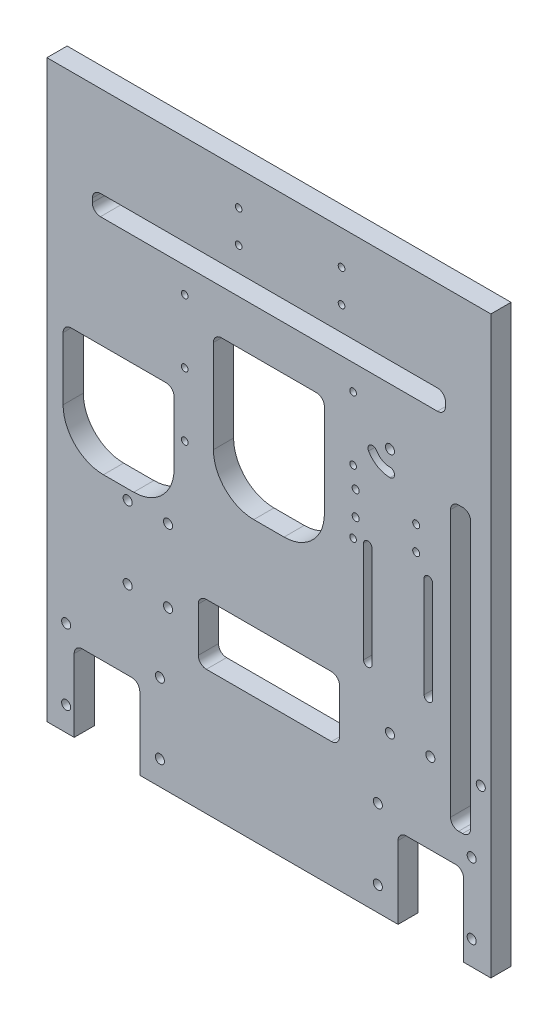
from build123d import *

# Parameters (mm, degrees)
ESQUISSE1_W                   = 220
ESQUISSE1_H                   = 285
BOSS_EXTRU_1_DEPTH            = 10
ESQUISSE2_R                   = 2
ENL_V_MAT_EXTRU_1_DEPTH       = 8
ENL_V_MAT_EXTRU_2_DEPTH       = 361.173569269
ENL_V_MAT_EXTRU_2_DEPTH_BACK  = 361.173569269
ESQUISSE3_W                   = 55
ESQUISSE3_H                   = 70
ESQUISSE3_H_2                 = 55
ESQUISSE3_W_2                 = 10
ESQUISSE3_H_3                 = 140
ENL_V_MAT_EXTRU_3_DEPTH       = 361.173569269
ENL_V_MAT_EXTRU_3_DEPTH_BACK  = 361.173569269
ESQUISSE5_W                   = 175
ESQUISSE5_H                   = 10
ENL_V_MAT_EXTRU_4_DEPTH       = 361.173569269
ENL_V_MAT_EXTRU_4_DEPTH_BACK  = 361.173569269
ESQUISSE6_R                   = 2.25
ESQUISSE6_R_2                 = 1.75
ENL_V_MAT_EXTRU_5_DEPTH       = 361.173569269
ENL_V_MAT_EXTRU_5_DEPTH_BACK  = 361.173569269
ESQUISSE7_R                   = 1.65
ENL_V_MAT_EXTRU_6_DEPTH       = 361.173569269
ENL_V_MAT_EXTRU_6_DEPTH_BACK  = 361.173569269
ESQUISSE8_W                   = 32.5
ESQUISSE8_H                   = 40
CONG_1_R                      = 20
ENL_V_MAT_EXTRU_7_DEPTH       = 361.173569269
ENL_V_MAT_EXTRU_7_DEPTH_BACK  = 361.173569269
ENL_V_MAT_EXTRU_8_DEPTH       = 361.173569269
ENL_V_MAT_EXTRU_8_DEPTH_BACK  = 361.173569269
ESQUISSE10_R                  = 2.25
ENL_V_MAT_EXTRU_9_DEPTH       = 361.173569269
ENL_V_MAT_EXTRU_9_DEPTH_BACK  = 361.173569269
ESQUISSE11_W                  = 70
ESQUISSE11_H                  = 30
CONG_2_R                      = 4
ENL_V_MAT_EXTRU_10_DEPTH      = 361.173569269
ENL_V_MAT_EXTRU_10_DEPTH_BACK = 361.173569269
ESQUISSE12_R                  = 2.25
ENL_V_MAT_EXTRU_11_DEPTH      = 361.173569269
ENL_V_MAT_EXTRU_11_DEPTH_BACK = 361.173569269
ESQUISSE13_R                  = 2.25


with BuildPart() as part:
    # Esquisse1 → Boss.-Extru.1 (new body)
    with BuildSketch(Plane.XY):
        with Locations((110, 142.5)):
            Rectangle(ESQUISSE1_W, ESQUISSE1_H)
    extrude(amount=BOSS_EXTRU_1_DEPTH)

    # Esquisse2 → Enlèv. mat.-Extru.1 (cut)
    with BuildSketch(Plane.XZ):
        with Locations((110, 5)):
            Circle(ESQUISSE2_R)
        with Locations((213, 5)):
            Circle(ESQUISSE2_R)
        with Locations((7, 5)):
            Circle(ESQUISSE2_R)
    extrude(amount=-ENL_V_MAT_EXTRU_1_DEPTH, mode=Mode.SUBTRACT)

    # Esquisse3 → Enlèv. mat.-Extru.2 (cut, two sides: drawn at the far end of the back side and taken through both)
    with BuildSketch(Plane.XY.offset(10).offset(-ENL_V_MAT_EXTRU_2_DEPTH_BACK)):
        with Locations((110, 173)):
            Rectangle(ESQUISSE3_W, ESQUISSE3_H)
        with Locations((35.5, 147.5)):
            Rectangle(ESQUISSE3_W, ESQUISSE3_H_2)
        with Locations((205, 125)):
            Rectangle(ESQUISSE3_W_2, ESQUISSE3_H_3)
    extrude(amount=ENL_V_MAT_EXTRU_2_DEPTH + ENL_V_MAT_EXTRU_2_DEPTH_BACK, mode=Mode.SUBTRACT)

    # Esquisse5 → Enlèv. mat.-Extru.3 (cut, two sides: drawn at the far end of the back side and taken through both)
    with BuildSketch(Plane.XY.offset(10).offset(-ENL_V_MAT_EXTRU_3_DEPTH_BACK)):
        with Locations((110, 235)):
            Rectangle(ESQUISSE5_W, ESQUISSE5_H)
    extrude(amount=ENL_V_MAT_EXTRU_3_DEPTH + ENL_V_MAT_EXTRU_3_DEPTH_BACK, mode=Mode.SUBTRACT)

    # Esquisse6 → Enlèv. mat.-Extru.4 (cut, two sides: drawn at the far end of the back side and taken through both)
    with BuildSketch(Plane.XY.offset(10).offset(-ENL_V_MAT_EXTRU_4_DEPTH_BACK)):
        with Locations((190, 80)):
            Circle(ESQUISSE6_R)
        with Locations((170, 80)):
            Circle(ESQUISSE6_R)
        with Locations((215, 80)):
            Circle(ESQUISSE6_R)
        with Locations((153, 176.25)):
            Circle(ESQUISSE6_R_2)
        with Locations((183, 176.25)):
            Circle(ESQUISSE6_R_2)
        with Locations((183, 164.25)):
            Circle(ESQUISSE6_R_2)
        with Locations((153, 164.25)):
            Circle(ESQUISSE6_R_2)
    extrude(amount=ENL_V_MAT_EXTRU_4_DEPTH + ENL_V_MAT_EXTRU_4_DEPTH_BACK, mode=Mode.SUBTRACT)

    # Esquisse7 → Enlèv. mat.-Extru.5 (cut, two sides: drawn at the far end of the back side and taken through both)
    with BuildSketch(Plane.XY.offset(10).offset(-ENL_V_MAT_EXTRU_5_DEPTH_BACK)):
        with Locations((68.285, 217.4)):
            Circle(ESQUISSE7_R)
        with Locations((68.285, 186)):
            Circle(ESQUISSE7_R)
        with Locations((68.285, 154.6)):
            Circle(ESQUISSE7_R)
        with Locations((151.715, 154.6)):
            Circle(ESQUISSE7_R)
        with Locations((151.715, 186)):
            Circle(ESQUISSE7_R)
        with Locations((151.715, 217.4)):
            Circle(ESQUISSE7_R)
        with Locations((95, 268)):
            Circle(ESQUISSE7_R)
        with Locations((146, 268)):
            Circle(ESQUISSE7_R)
        with Locations((146, 252)):
            Circle(ESQUISSE7_R)
        with Locations((95, 252)):
            Circle(ESQUISSE7_R)
    extrude(amount=ENL_V_MAT_EXTRU_5_DEPTH + ENL_V_MAT_EXTRU_5_DEPTH_BACK, mode=Mode.SUBTRACT)

    # Esquisse8 → Enlèv. mat.-Extru.6 (cut, two sides: drawn at the far end of the back side and taken through both)
    with BuildSketch(Plane.XY.offset(10).offset(-ENL_V_MAT_EXTRU_6_DEPTH_BACK)):
        with Locations((190.25, 20)):
            Rectangle(ESQUISSE8_W, ESQUISSE8_H)
        with Locations((29.75, 20)):
            Rectangle(ESQUISSE8_W, ESQUISSE8_H)
    extrude(amount=ENL_V_MAT_EXTRU_6_DEPTH + ENL_V_MAT_EXTRU_6_DEPTH_BACK, mode=Mode.SUBTRACT)

    # Congé1
    cong_1_edges = [part.edges().sort_by_distance(p)[0] for p in [
        (137.5, 138, 5),
        (82.5, 138, 5),
        (63, 120, 5),
        (8, 120, 5),
    ]]
    fillet(cong_1_edges, radius=CONG_1_R)

    # Esquisse9 → Enlèv. mat.-Extru.7 (cut, two sides: drawn at the far end of the back side and taken through both)
    with BuildSketch(Plane.XY.offset(10).offset(-ENL_V_MAT_EXTRU_7_DEPTH_BACK)):
        with BuildLine():
            Line((191.1, 155), (191.1, 105))
            ThreePointArc((191.1, 105), (189, 102.9), (186.9, 105))
            Line((186.9, 105), (186.9, 155))
            ThreePointArc((186.9, 155), (189, 157.1), (191.1, 155))
        make_face()
        with BuildLine():
            Line((156.9, 105), (156.9, 155))
            ThreePointArc((156.9, 155), (159, 157.1), (161.1, 155))
            Line((161.1, 155), (161.1, 105))
            ThreePointArc((161.1, 105), (159, 102.9), (156.9, 105))
        make_face()
    extrude(amount=ENL_V_MAT_EXTRU_7_DEPTH + ENL_V_MAT_EXTRU_7_DEPTH_BACK, mode=Mode.SUBTRACT)

    # Esquisse10 → Enlèv. mat.-Extru.8 (cut, two sides: drawn at the far end of the back side and taken through both)
    with BuildSketch(Plane.XY.offset(10).offset(-ENL_V_MAT_EXTRU_8_DEPTH_BACK)):
        with Locations((9.5, 12)):
            Circle(ESQUISSE10_R)
        with Locations((9.5, 47)):
            Circle(ESQUISSE10_R)
        with Locations((210.5, 47)):
            Circle(ESQUISSE10_R)
        with Locations((210.5, 12)):
            Circle(ESQUISSE10_R)
        with Locations((56, 47)):
            Circle(ESQUISSE10_R)
        with Locations((56, 12)):
            Circle(ESQUISSE10_R)
        with Locations((164, 12)):
            Circle(ESQUISSE10_R)
        with Locations((164, 47)):
            Circle(ESQUISSE10_R)
    extrude(amount=ENL_V_MAT_EXTRU_8_DEPTH + ENL_V_MAT_EXTRU_8_DEPTH_BACK, mode=Mode.SUBTRACT)

    # Esquisse11 → Enlèv. mat.-Extru.9 (cut, two sides: drawn at the far end of the back side and taken through both)
    with BuildSketch(Plane.XY.offset(10).offset(-ENL_V_MAT_EXTRU_9_DEPTH_BACK)):
        with Locations((110, 77)):
            Rectangle(ESQUISSE11_W, ESQUISSE11_H)
    extrude(amount=ENL_V_MAT_EXTRU_9_DEPTH + ENL_V_MAT_EXTRU_9_DEPTH_BACK, mode=Mode.SUBTRACT)

    # Congé2
    cong_2_edges = [part.edges().sort_by_distance(p)[0] for p in [
        (137.5, 208, 5),
        (82.5, 208, 5),
        (197.5, 230, 5),
        (197.5, 240, 5),
        (22.5, 240, 5),
        (22.5, 230, 5),
        (63, 175, 5),
        (8, 175, 5),
        (200, 195, 5),
        (210, 195, 5),
        (210, 55, 5),
        (200, 55, 5),
        (206.5, 40, 5),
        (174, 40, 5),
        (46, 40, 5),
        (13.5, 40, 5),
        (75, 62, 5),
        (145, 62, 5),
        (145, 92, 5),
        (75, 92, 5),
    ]]
    fillet(cong_2_edges, radius=CONG_2_R)

    # Esquisse12 → Enlèv. mat.-Extru.10 (cut, two sides: drawn at the far end of the back side and taken through both)
    with BuildSketch(Plane.XY.offset(10).offset(-ENL_V_MAT_EXTRU_10_DEPTH_BACK)):
        with Locations((170, 202)):
            Circle(ESQUISSE12_R)
        with BuildLine():
            ThreePointArc((159.391188804, 195.875), (163.875, 191.391188804), (170, 189.75))
            ThreePointArc((170, 189.75), (172.25, 192), (170, 194.25))
            ThreePointArc((170, 194.25), (166.125, 195.288303121), (163.288303121, 198.125))
            ThreePointArc((163.288303121, 198.125), (160.214745962, 198.948557159), (159.391188804, 195.875))
        make_face()
    extrude(amount=ENL_V_MAT_EXTRU_10_DEPTH + ENL_V_MAT_EXTRU_10_DEPTH_BACK, mode=Mode.SUBTRACT)

    # Esquisse13 → Enlèv. mat.-Extru.11 (cut, two sides: drawn at the far end of the back side and taken through both)
    with BuildSketch(Plane.XY.offset(10).offset(-ENL_V_MAT_EXTRU_11_DEPTH_BACK)):
        with Locations((40, 115)):
            Circle(ESQUISSE13_R)
        with Locations((60, 115)):
            Circle(ESQUISSE13_R)
        with Locations((60, 79)):
            Circle(ESQUISSE13_R)
        with Locations((40, 79)):
            Circle(ESQUISSE13_R)
    extrude(amount=ENL_V_MAT_EXTRU_11_DEPTH + ENL_V_MAT_EXTRU_11_DEPTH_BACK, mode=Mode.SUBTRACT)


solid = part.part
